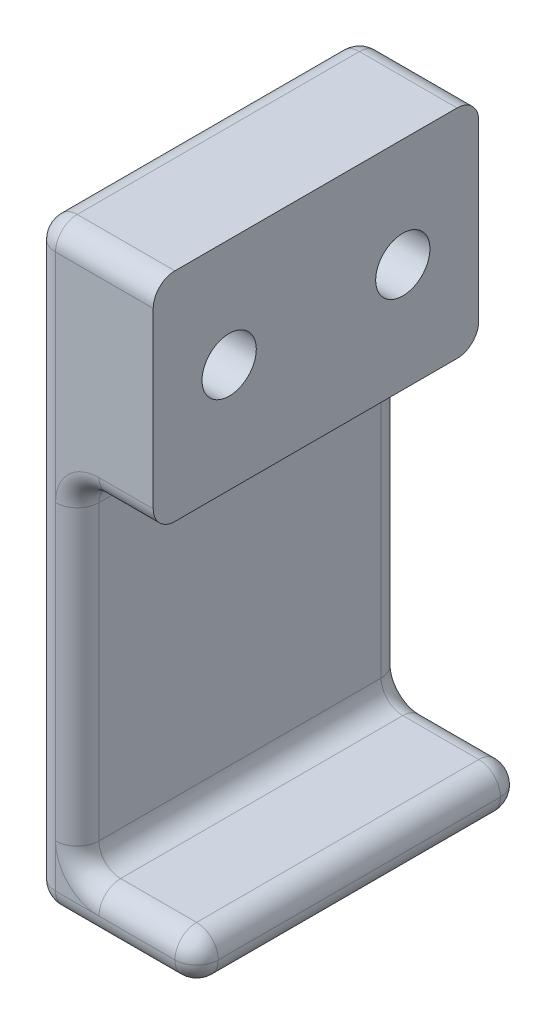
from build123d import *

# Parameters (mm, degrees)
EXTRUDE_1_DEPTH     = 30
SKETCH_3_W          = 7
SKETCH_3_H          = 20
EXTRUDE_2_DEPTH     = 30
SKETCH_2_R          = 2.5
CUT_EXTRUDE_1_DEPTH = 30
FILLET_1_R          = 2
FILLET_2_R          = 2
FILLET_3_R          = 2
FILLET_5_R          = 2
SKETCH_4_R          = 5
CUT_EXTRUDE_2_DEPTH = 5


with BuildPart() as part:
    # 스케치1 → 보스-돌출1 (new body)
    with BuildSketch(Plane.XY):
        Polygon((-41.818181818, 31.136363636), (-37.818181818, 31.136363636), (-37.818181818, -19.863636364), (-26.818181818, -19.863636364), (-26.818181818, -23.863636364), (-32.727272727, -23.863636364), (-41.818181818, -23.863636364), align=None)
    extrude(amount=EXTRUDE_1_DEPTH)

    # 스케치3 → 보스-돌출2 (add)
    with BuildSketch(Plane.XY.offset(30)):
        with Locations((-34.318181818, 21.136363636)):
            Rectangle(SKETCH_3_W, SKETCH_3_H)
    extrude(amount=-EXTRUDE_2_DEPTH)

    # 스케치2 → 컷-돌출1 (cut)
    with BuildSketch(Plane.ZY.offset(41.818181818)):
        with Locations((7, 21.136363636)):
            Circle(SKETCH_2_R)
        with Locations((23, 21.136363636)):
            Circle(SKETCH_2_R)
    extrude(amount=-CUT_EXTRUDE_1_DEPTH, mode=Mode.SUBTRACT)

    # 필렛1
    fillet_1_edges = [part.edges().sort_by_distance(p)[0] for p in [
        (-37.818181818, -19.863636364, 15),
        (-37.818181818, 11.136363636, 15),
    ]]
    fillet(fillet_1_edges, radius=FILLET_1_R)

    # 필렛2
    fillet_2_edges = [part.edges().sort_by_distance(p)[0] for p in [
        (-41.818181818, -23.863636364, 15),
    ]]
    fillet(fillet_2_edges, radius=FILLET_2_R)

    # 필렛3
    fillet_3_edges = [part.edges().sort_by_distance(p)[0] for p in [
        (-26.818181818, -23.863636364, 15),
        (-26.818181818, -19.863636364, 15),
        (-41.818181818, 31.136363636, 15),
    ]]
    fillet(fillet_3_edges, radius=FILLET_3_R - 0.0001)  # a hair under: the kernel refuses the full size

    # 필렛5
    fillet_5_edges = [part.edges().sort_by_distance(p)[0] for p in [
        (-35.318231818, 31.136363636, 30),
        (-33.318181818, 11.136363636, 0),
        (-37.818181818, -4.363636364, 0),
        (-37.818181818, -4.363636364, 30),
        (-33.318181818, 11.136363636, 30),
        (-37.232395381, 10.550577199, 30),
        (-37.232395381, 10.550577199, 0),
        (-37.232395381, -19.277849926, 0),
        (-37.232395381, -19.277849926, 30),
        (-34.318131818, -23.863636364, 0),
        (-34.318131818, -23.863636364, 30),
        (-41.232395381, -23.277849926, 0),
        (-41.232395381, -23.277849926, 30),
        (-41.818181818, 3.636413636, 0),
        (-32.318131818, -19.863636364, 0),
        (-41.23242467, 30.550606488, 0),
        (-27.403938966, -20.449393512, 0),
        (-27.403938966, -23.277879215, 0),
        (-41.818181818, 3.636413636, 30),
        (-35.318231818, 31.136363636, 0),
        (-32.318131818, -19.863636364, 30),
        (-41.23242467, 30.550606488, 30),
        (-27.403938966, -20.449393512, 30),
        (-27.403938966, -23.277879215, 30),
    ]]
    fillet(fillet_5_edges, radius=FILLET_5_R - 0.0001)  # a hair under: the kernel refuses the full size

    # 스케치4 → 컷-돌출2 (cut)
    with BuildSketch(Plane.ZY.offset(41.818181818)):
        with Locations((7, 21.136363636)):
            Circle(SKETCH_4_R)
        with Locations((23, 21.136363636)):
            Circle(SKETCH_4_R)
    extrude(amount=-CUT_EXTRUDE_2_DEPTH, mode=Mode.SUBTRACT)


solid = part.part
